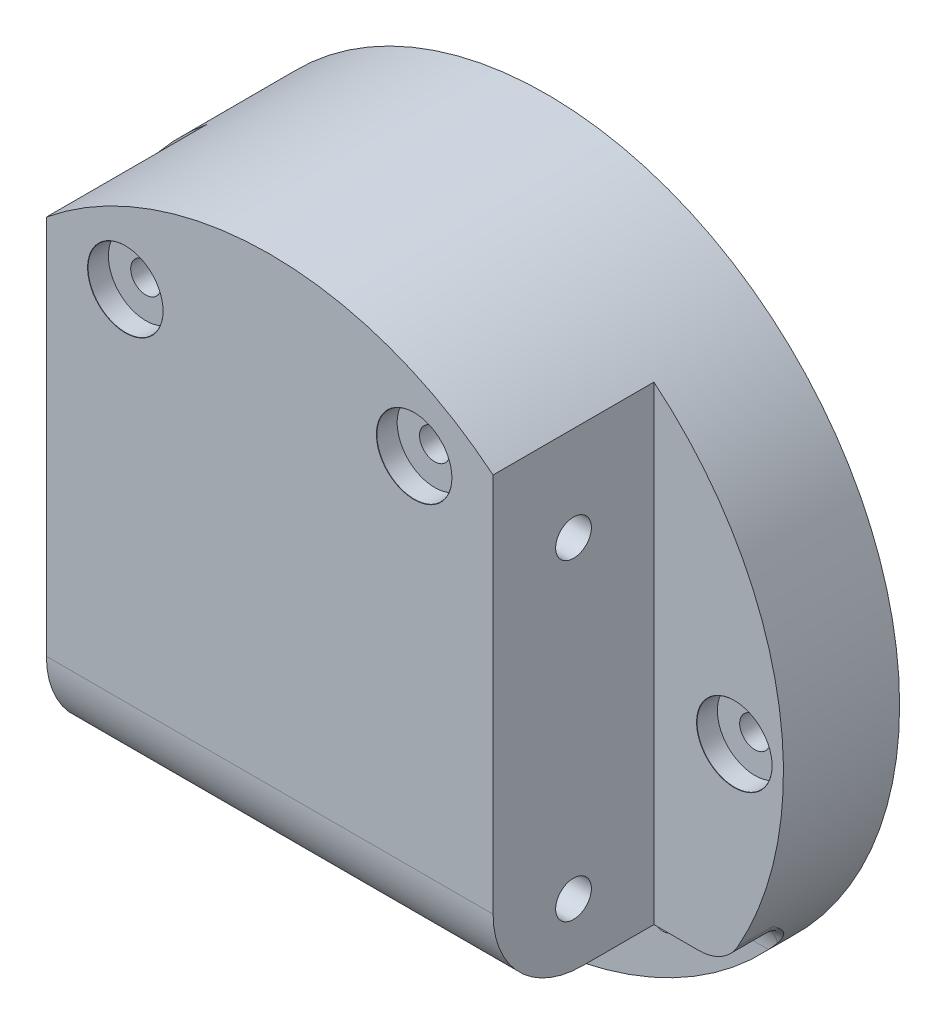
from build123d import *

# Parameters (mm, degrees)
SKETCH1_R                                     = 39.5
SKETCH1_R_2                                   = 28.5
BOSS_EXTRUDE1_DEPTH                           = 11
SKETCH2_R                                     = 39.5
BOSS_EXTRUDE2_DEPTH                           = 20
CUT_EXTRUDE3_START                            = -27
CUT_EXTRUDE3_DEPTH                            = 27
CUT_EXTRUDE4_START                            = -18
CUT_EXTRUDE4_DEPTH                            = 18
CBORE_FOR_M3_HEX_HEAD_MACHINE_SCREW1_AT_COUNT = 2
CBORE_FOR_M3_HEX_HEAD_MACHINE_SCREW1_AT_PITCH = 68
CBORE_FOR_M3_HEX_HEAD_MACHINE_SCREW1_2_COUNT  = 2
CBORE_FOR_M3_HEX_HEAD_MACHINE_SCREW1_2_PITCH  = 58.889727457
CBORE_FOR_M3_HEX_HEAD_MACHINE_SCREW1_3_COUNT  = 2
CBORE_FOR_M3_HEX_HEAD_MACHINE_SCREW1_3_PITCH  = 34
FILLET2_R                                     = 2
CBORE_FOR_M3_HEX_HEAD_MACHINE_SCREW2_AT_COUNT = 2
CBORE_FOR_M3_HEX_HEAD_MACHINE_SCREW2_AT_PITCH = 32.326095378
CUT_EXTRUDE5_DEPTH                            = 82.740442866
CUT_EXTRUDE5_DEPTH_BACK                       = 82.740442866
SKETCH10_R                                    = 2
FILLET5_R                                     = 5
FILLET4_R                                     = 5
FILLET6_R                                     = 1
FILLET7_R                                     = 10


with BuildPart() as part:
    # Sketch1 → Boss-Extrude1 (new body)
    with BuildSketch(Plane.XY):
        Circle(SKETCH1_R)
        Circle(SKETCH1_R_2, mode=Mode.SUBTRACT)
    extrude(amount=BOSS_EXTRUDE1_DEPTH)

    # Sketch2 → Boss-Extrude2 (add)
    with BuildSketch(Plane.XY.offset(11)):
        Circle(SKETCH2_R)
    extrude(amount=BOSS_EXTRUDE2_DEPTH)

    # Sketch3 → Cut-Extrude3 (cut)
    with BuildSketch(Plane.XY.offset(31).offset(CUT_EXTRUDE3_START)):
        with BuildLine():
            ThreePointArc((-32.806249405, -22), (0, -39.5), (32.806249405, -22))
            Line((32.806249405, -22), (-32.806249405, -22))
        make_face()
    extrude(amount=CUT_EXTRUDE3_DEPTH, mode=Mode.SUBTRACT)

    # Sketch4 → Cut-Extrude4 (cut)
    with BuildSketch(Plane.XY.offset(31).offset(CUT_EXTRUDE4_START)):
        with BuildLine():
            Line((-32.806249405, -22), (-25, -22))
            Line((-25, -22), (-25, 30.581857367))
            ThreePointArc((-25, 30.581857367), (-39.071774321, 5.800556129), (-32.806249405, -22))
        make_face()
        with BuildLine():
            Line((25, 30.581857367), (25, -22))
            Line((25, -22), (32.806249405, -22))
            ThreePointArc((32.806249405, -22), (39.071774321, 5.800556129), (25, 30.581857367))
        make_face()
    extrude(amount=CUT_EXTRUDE4_DEPTH, mode=Mode.SUBTRACT)

    # Sketch6 → CBORE for M3 Hex Head Machine Screw1 (revolve, cut)
    with BuildSketch(Plane(origin=(-34, 0, 13), x_dir=(0, -1, 0), z_dir=(1, 0, 0))):
        Polygon((0, 0), (0, 13), (1.7, 13), (1.7, 2.3), (4.2, 2.3), (4.2, 0.025), (4.225, 0), align=None)
    cbore_for_m3_hex_head_machine_screw1 = revolve(axis=Axis((-34, 0, 19.35), (0, 0, -1)), mode=Mode.SUBTRACT)

    # CBORE for M3 Hex Head Machine Screw1 at: CBORE for M3 Hex Head Machine Screw1 ×2
    with Locations(*[(i * CBORE_FOR_M3_HEX_HEAD_MACHINE_SCREW1_AT_PITCH, 0, 0) for i in range(1, CBORE_FOR_M3_HEX_HEAD_MACHINE_SCREW1_AT_COUNT)]):
        add(cbore_for_m3_hex_head_machine_screw1, mode=Mode.SUBTRACT)

    # CBORE for M3 Hex Head Machine Screw1 2: CBORE for M3 Hex Head Machine Screw1 ×2
    with Locations(*[Vector(0.8660254037844364, -0.500000000000004, 0) * (i * CBORE_FOR_M3_HEX_HEAD_MACHINE_SCREW1_2_PITCH) for i in range(1, CBORE_FOR_M3_HEX_HEAD_MACHINE_SCREW1_2_COUNT)]):
        add(cbore_for_m3_hex_head_machine_screw1, mode=Mode.SUBTRACT)

    # CBORE for M3 Hex Head Machine Screw1 3: CBORE for M3 Hex Head Machine Screw1 ×2
    with Locations(*[Vector(0.4999999999999949, -0.8660254037844417, 0) * (i * CBORE_FOR_M3_HEX_HEAD_MACHINE_SCREW1_3_PITCH) for i in range(1, CBORE_FOR_M3_HEX_HEAD_MACHINE_SCREW1_3_COUNT)]):
        add(cbore_for_m3_hex_head_machine_screw1, mode=Mode.SUBTRACT)

    # Fillet2
    fillet2_edges = [part.edges().sort_by_distance(p)[0] for p in [
        (-18.117670932, -22, 7.5),
        (18.117670932, -22, 7.5),
    ]]
    fillet(fillet2_edges, radius=FILLET2_R)

    # Sketch8 → CBORE for M3 Hex Head Machine Screw2 (revolve, cut)
    with BuildSketch(Plane(origin=(-16.163047689, 27.995219802, 31), x_dir=(0, -1, 0), z_dir=(1, 0, 0))):
        Polygon((0, 0), (0, 31), (1.7, 31), (1.7, 2.3), (4.2, 2.3), (4.2, 0.025), (4.225, 0), align=None)
    cbore_for_m3_hex_head_machine_screw2 = revolve(axis=Axis((-16.163047689, 27.995219802, 37.35), (0, 0, -1)), mode=Mode.SUBTRACT)

    # CBORE for M3 Hex Head Machine Screw2 at: CBORE for M3 Hex Head Machine Screw2 ×2
    with Locations(*[(i * CBORE_FOR_M3_HEX_HEAD_MACHINE_SCREW2_AT_PITCH, 0, 0) for i in range(1, CBORE_FOR_M3_HEX_HEAD_MACHINE_SCREW2_AT_COUNT)]):
        add(cbore_for_m3_hex_head_machine_screw2, mode=Mode.SUBTRACT)

    # Sketch10 → Cut-Extrude5 (cut, two sides: drawn at the far end of the back side and taken through both)
    with BuildSketch(Plane.ZY.offset(25).offset(-CUT_EXTRUDE5_DEPTH_BACK)):
        with Locations(Location((22, 20, 0), (0, 0, 180))):
            Circle(SKETCH10_R)
        with Locations(Location((22, -15, 0), (0, 0, 180))):
            Circle(SKETCH10_R)
    extrude(amount=CUT_EXTRUDE5_DEPTH + CUT_EXTRUDE5_DEPTH_BACK, mode=Mode.SUBTRACT)

    # Fillet5
    fillet5_edges = [part.edges().sort_by_distance(p)[0] for p in [
        (32.806249405, -22, 8.5),
        (-32.806249405, -22, 8.5),
    ]]
    fillet(fillet5_edges, radius=FILLET5_R)

    # Fillet4
    # the kernel refuses this fillet: 5 mm, written as the material it adds along each edge
    with BuildSketch(Plane(origin=(-23.027157879, -22, 4), x_dir=(0, 0, 1), z_dir=(-1, 0, 0))) as fillet4_piece_1_section:
        with BuildLine():
            CenterArc((FILLET4_R, -FILLET4_R), FILLET4_R, 90, 90)
            Line((0, -FILLET4_R), (0, 0))
            Line((0, 0), (FILLET4_R, 0))
        make_face()
    fillet4_piece_1 = extrude(amount=6.993668225, mode=Mode.PRIVATE)
    fillet4_piece_1 = fillet4_piece_1 & Plane(origin=(0, 0, 5.117497097), x_dir=(1, 0, 0), z_dir=(0, 0, -1)) * Cylinder(39.5, 34, mode=Mode.PRIVATE)
    add(fillet4_piece_1)
    with BuildSketch(Plane(origin=(30.020826105, -17, 4), x_dir=(0, -1, 0), z_dir=(-1, 0, 0))) as fillet4_piece_2_section:
        with BuildLine():
            CenterArc((5 + FILLET4_R, FILLET4_R), FILLET4_R, 180, 90)
            Line((5 + FILLET4_R, 0), (5, 0))
            Line((5, 0), (5, FILLET4_R))
        make_face()
    fillet4_piece_2 = revolve(axis=Axis((30.020826105, -17, 4), (0, 0, 1)), revolution_arc=203.743697153, mode=Mode.PRIVATE)
    fillet4_piece_2 = fillet4_piece_2 - Plane(origin=(0, 0, 5.881838576), x_dir=(1, 0, 0), z_dir=(0, 0, -1)) * Cylinder(28.5, 40, mode=Mode.PRIVATE)
    fillet4_piece_2 = fillet4_piece_2 & Plane(origin=(0, 0, 5.881838576), x_dir=(1, 0, 0), z_dir=(0, 0, -1)) * Cylinder(39.5, 40, mode=Mode.PRIVATE)
    add(fillet4_piece_2)
    with BuildSketch(Plane(origin=(-30.020826105, -17, 4), x_dir=(0, -1, 0), z_dir=(1, 0, 0))) as fillet4_piece_3_section:
        with BuildLine():
            CenterArc((5 + FILLET4_R, -FILLET4_R), FILLET4_R, 90, 90)
            Line((5 + FILLET4_R, 0), (5, 0))
            Line((5, 0), (5, -FILLET4_R))
        make_face()
    fillet4_piece_3 = revolve(axis=Axis((-30.020826105, -17, 4), (0, 0, -1)), revolution_arc=203.743697153, mode=Mode.PRIVATE)
    fillet4_piece_3 = fillet4_piece_3 - Plane(origin=(0, 0, 5.881838618), x_dir=(1, 0, 0), z_dir=(0, 0, -1)) * Cylinder(28.5, 40, mode=Mode.PRIVATE)
    fillet4_piece_3 = fillet4_piece_3 & Plane(origin=(0, 0, 5.881838618), x_dir=(1, 0, 0), z_dir=(0, 0, -1)) * Cylinder(39.5, 40, mode=Mode.PRIVATE)
    add(fillet4_piece_3)
    with BuildSketch(Plane(origin=(30.020826105, -22, 4), x_dir=(0, 0, 1), z_dir=(-1, 0, 0))) as fillet4_piece_4_section:
        with BuildLine():
            CenterArc((FILLET4_R, -FILLET4_R), FILLET4_R, 90, 90)
            Line((0, -FILLET4_R), (0, 0))
            Line((0, 0), (FILLET4_R, 0))
        make_face()
    fillet4_piece_4 = extrude(amount=6.993668225, mode=Mode.PRIVATE)
    fillet4_piece_4 = fillet4_piece_4 & Plane(origin=(0, 0, 5.117497097), x_dir=(1, 0, 0), z_dir=(0, 0, -1)) * Cylinder(39.5, 34, mode=Mode.PRIVATE)
    add(fillet4_piece_4)
    with BuildSketch(Plane(origin=(-23.027157879, -20, 4), x_dir=(0, -1, 0), z_dir=(-1, 0, 0))) as fillet4_piece_5_section:
        with BuildLine():
            CenterArc((2 + FILLET4_R, FILLET4_R), FILLET4_R, 180, 90)
            Line((2 + FILLET4_R, 0), (2, 0))
            Line((2, 0), (2, FILLET4_R))
        make_face()
    fillet4_piece_5 = revolve(axis=Axis((-23.027157879, -20, 4), (0, 0, 1)), revolution_arc=359.64, mode=Mode.PRIVATE)
    fillet4_piece_5 = fillet4_piece_5 - Plane(origin=(0, 0, 5.416079677), x_dir=(1, 0, 0), z_dir=(0, 0, -1)) * Cylinder(28.5, 28, mode=Mode.PRIVATE)
    add(fillet4_piece_5)
    with BuildSketch(Plane(origin=(23.027157879, -20, 4), x_dir=(0, -1, 0), z_dir=(1, 0, 0))) as fillet4_piece_6_section:
        with BuildLine():
            CenterArc((2 + FILLET4_R, -FILLET4_R), FILLET4_R, 90, 90)
            Line((2 + FILLET4_R, 0), (2, 0))
            Line((2, 0), (2, -FILLET4_R))
        make_face()
    fillet4_piece_6 = revolve(axis=Axis((23.027157879, -20, 4), (0, 0, -1)), revolution_arc=359.64, mode=Mode.PRIVATE)
    fillet4_piece_6 = fillet4_piece_6 - Plane(origin=(0, 0, 5.416079623), x_dir=(1, 0, 0), z_dir=(0, 0, -1)) * Cylinder(28.5, 28, mode=Mode.PRIVATE)
    add(fillet4_piece_6)

    # Fillet6
    # the kernel refuses this fillet: 1 mm, written as the material it adds along each edge
    with BuildSketch(Plane(origin=(0, 0, 11), x_dir=(1, 0, 0), z_dir=(0, -1, 0))) as fillet6_piece_1:
        with BuildLine():
            CenterArc((28.5 - FILLET6_R, -FILLET6_R), FILLET6_R, 0, 90)
            Line((28.5 - FILLET6_R, 0), (28.5, 0))
            Line((28.5, 0), (28.5, -FILLET6_R))
        make_face()
    revolve(axis=Axis((0, 0, 11), (0, 0, 1)), revolution_arc=220.975610343)
    with BuildSketch(Plane(origin=(-23.027157879, -20, 11), x_dir=(-0.9493195168959316, -0.31431267050578, 0), z_dir=(-0.31431267050578, 0.9493195168959316, 0))) as fillet6_piece_2_section:
        with BuildLine():
            CenterArc((2 + FILLET6_R, -FILLET6_R), FILLET6_R, 90, 90)
            Line((2, -FILLET6_R), (2, 0))
            Line((2, 0), (2 + FILLET6_R, 0))
        make_face()
    fillet6_piece_2 = revolve(axis=Axis((-23.027157879, -20, 11), (0, 0, 1)), revolution_arc=202.656285008, mode=Mode.PRIVATE)
    fillet6_piece_2 = split(fillet6_piece_2, bisect_by=Plane(origin=(-21.199330991, -22, 10.4999997), z_dir=(0, 1, 0)), keep=Keep.TOP, mode=Mode.PRIVATE)
    add(fillet6_piece_2)
    with BuildSketch(Plane(origin=(23.027157879, -20, 11), x_dir=(0.9493195168959316, -0.31431267050578, 0), z_dir=(0.31431267050578, 0.9493195168959316, 0))) as fillet6_piece_3_section:
        with BuildLine():
            CenterArc((2 + FILLET6_R, FILLET6_R), FILLET6_R, 180, 90)
            Line((2 + FILLET6_R, 0), (2, 0))
            Line((2, 0), (2, FILLET6_R))
        make_face()
    fillet6_piece_3 = revolve(axis=Axis((23.027157879, -20, 11), (0, 0, -1)), revolution_arc=202.656285008, mode=Mode.PRIVATE)
    fillet6_piece_3 = split(fillet6_piece_3, bisect_by=Plane(origin=(20.946630344, -22, 10.713386851), z_dir=(0, 1, 0)), keep=Keep.TOP, mode=Mode.PRIVATE)
    add(fillet6_piece_3)
    with BuildSketch(Plane(origin=(0, 0, 11), x_dir=(0.7549887829291444, -0.6557377049180327, 0), z_dir=(-0.6557377049180327, -0.7549887829291444, 0))) as fillet6_piece_4:
        with BuildLine():
            CenterArc((28.5 - FILLET6_R, -FILLET6_R), FILLET6_R, 0, 90)
            Line((28.5 - FILLET6_R, 0), (28.5, 0))
            Line((28.5, 0), (28.5, -FILLET6_R))
        make_face()
    revolve(axis=Axis((0, 0, 11), (0, 0, 1)), revolution_arc=40.975610343)

    # Fillet7
    fillet7_edges = [part.edges().sort_by_distance(p)[0] for p in [
        (0, -22, 31),
    ]]
    fillet(fillet7_edges, radius=FILLET7_R)


solid = part.part
